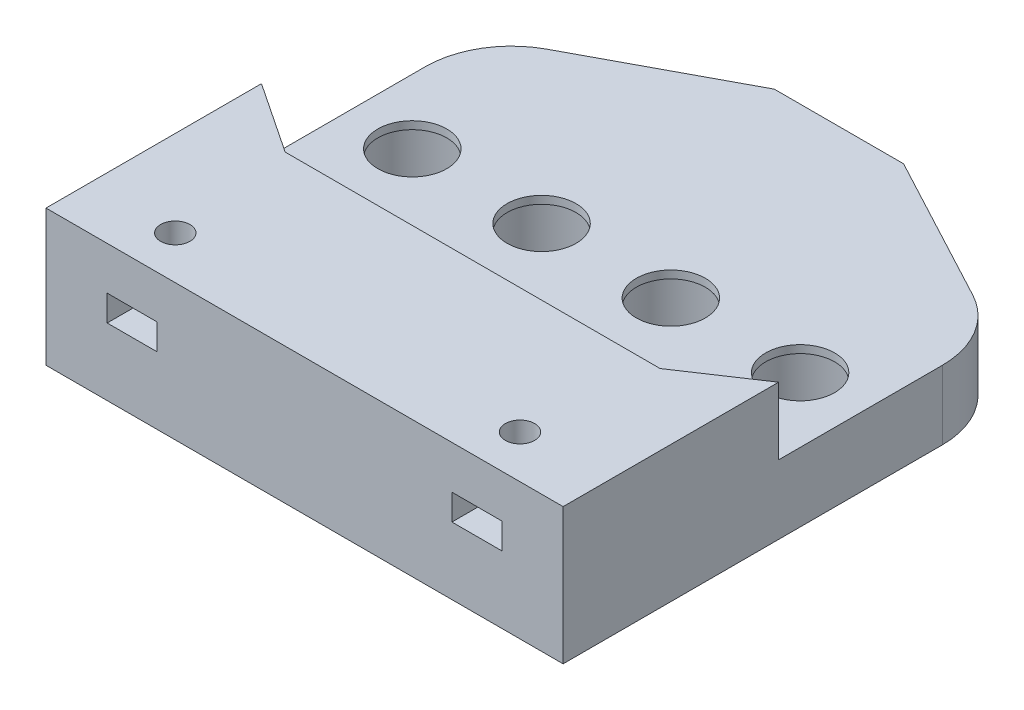
from build123d import *

# Parameters (mm, degrees)
SKETCH2_R           = 4
BOSS_EXTRUDE1_DEPTH = 8
BOSS_EXTRUDE2_DEPTH = 7.8
SKETCH5_R           = 6.55
CUT_EXTRUDE2_DEPTH  = 7.1
FILLET1_R           = 10
SKETCH7_W           = 60
SKETCH7_H           = 15.8
BOSS_EXTRUDE3_DEPTH = 15
SKETCH8_R           = 1.7
CUT_EXTRUDE3_DEPTH  = 10
CUT_EXTRUDE4_START  = -5
CUT_EXTRUDE4_DEPTH  = 3
SKETCH10_R          = 2.2
CUT_EXTRUDE5_DEPTH  = 7
SKETCH11_R          = 2.2
CUT_EXTRUDE6_DEPTH  = 8


with BuildPart() as part:
    # Sketch2 → Boss-Extrude1 (new body)
    with BuildSketch(Plane(origin=(0, 0, 0), x_dir=(1, 0, 0), z_dir=(0, 1, 0))):
        Polygon((0, 0), (0, 35), (22.5, 47), (37.5, 47), (60, 35), (60, 0), align=None)
        with Locations((7.5, 20)):
            Circle(SKETCH2_R, mode=Mode.SUBTRACT)
        with Locations((22.5, 20)):
            Circle(SKETCH2_R, mode=Mode.SUBTRACT)
        with Locations((37.5, 20)):
            Circle(SKETCH2_R, mode=Mode.SUBTRACT)
        with Locations((52.5, 20)):
            Circle(SKETCH2_R, mode=Mode.SUBTRACT)
    extrude(amount=BOSS_EXTRUDE1_DEPTH)

    # Sketch3 → Boss-Extrude2 (add)
    with BuildSketch(Plane(origin=(0, 8, 0), x_dir=(1, 0, 0), z_dir=(0, 1, 0))):
        Polygon((0, 10), (0, 0), (60, 0), (60, 10), (51.75, 4.5), (8.25, 4.5), align=None)
    extrude(amount=BOSS_EXTRUDE2_DEPTH)

    # Sketch5 → Cut-Extrude2 (cut)
    with BuildSketch(Plane(origin=(0, 0, 0), x_dir=(1, 0, 0), z_dir=(0, 1, 0))):
        with Locations((7.5, 20)):
            Circle(SKETCH5_R)
        with Locations((22.5, 20)):
            Circle(SKETCH5_R)
        with Locations((37.5, 20)):
            Circle(SKETCH5_R)
        with Locations((52.5, 20)):
            Circle(SKETCH5_R)
    extrude(amount=CUT_EXTRUDE2_DEPTH, mode=Mode.SUBTRACT)

    # Fillet1
    fillet1_edges = [part.edges().sort_by_distance(p)[0] for p in [
        (0, 4, -35),
        (60, 4, -35),
    ]]
    fillet(fillet1_edges, radius=FILLET1_R)

    # Sketch7 → Boss-Extrude3 (add)
    with BuildSketch(Plane.XY):
        with Locations((30, 7.9)):
            Rectangle(SKETCH7_W, SKETCH7_H)
    extrude(amount=BOSS_EXTRUDE3_DEPTH)

    # Sketch8 → Cut-Extrude3 (cut)
    with BuildSketch(Plane(origin=(0, 15.8, 0), x_dir=(1, 0, 0), z_dir=(0, 1, 0))):
        with Locations((10, -10)):
            Circle(SKETCH8_R)
        with Locations((50, -10)):
            Circle(SKETCH8_R)
    extrude(amount=-CUT_EXTRUDE3_DEPTH, mode=Mode.SUBTRACT)

    # Sketch9 → Cut-Extrude4 (cut)
    with BuildSketch(Plane(origin=(0, 15.8, 0), x_dir=(1, 0, 0), z_dir=(0, 1, 0)).offset(CUT_EXTRUDE4_START)):
        Polygon((52.9, -8.325684219), (50, -6.651368439), (47.1, -8.325684219), (47.1, -15), (52.9, -15), align=None)
        Polygon((7.1, -15), (12.9, -15), (12.9, -8.325684219), (10, -6.651368439), (7.1, -8.325684219), align=None)
    extrude(amount=-CUT_EXTRUDE4_DEPTH, mode=Mode.SUBTRACT)

    # Sketch10 → Cut-Extrude5 (cut)
    with BuildSketch(Plane(origin=(0, 0, 0), x_dir=(-1, 0, 0), z_dir=(0, -1, 0))):
        with Locations((-25, 39)):
            Circle(SKETCH10_R)
        with Locations((-35, 39)):
            Circle(SKETCH10_R)
        with Locations((-25, 1)):
            Circle(SKETCH10_R)
        with Locations((-35, 1)):
            Circle(SKETCH10_R)
    extrude(amount=-CUT_EXTRUDE5_DEPTH, mode=Mode.SUBTRACT)

    # Sketch11 → Cut-Extrude6 (cut)
    with BuildSketch(Plane(origin=(0, 0, 0), x_dir=(-1, 0, 0), z_dir=(0, -1, 0))):
        with Locations((-23, -10)):
            Circle(SKETCH11_R)
        with Locations((-37, -10)):
            Circle(SKETCH11_R)
    extrude(amount=-CUT_EXTRUDE6_DEPTH, mode=Mode.SUBTRACT)


solid = part.part
